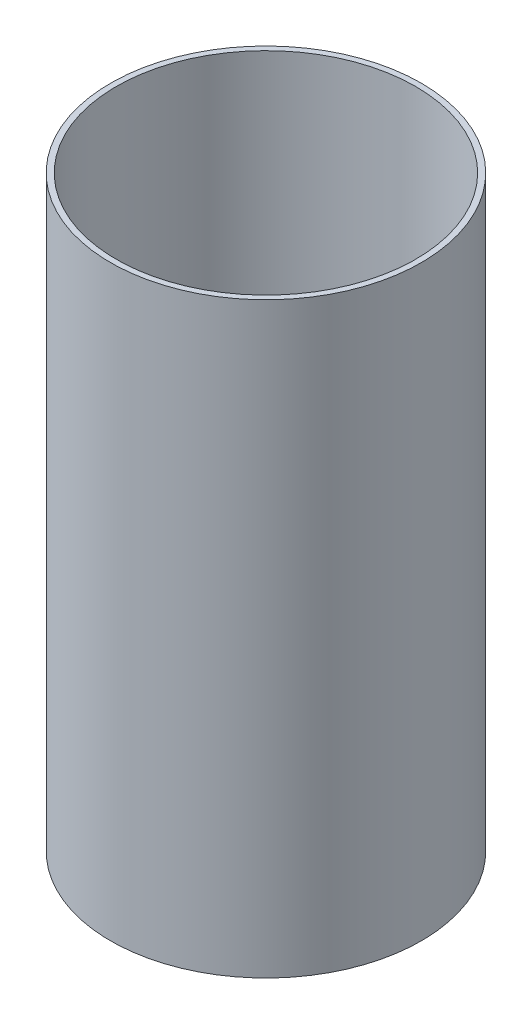
from build123d import *

# Parameters (mm, degrees)
SKETCH1_R           = 44.45
SKETCH1_R_2         = 42.82
BOSS_EXTRUDE1_DEPTH = 168


with BuildPart() as part:
    # Sketch1 → Boss-Extrude1 (new body)
    with BuildSketch(Plane(origin=(0, 0, 0), x_dir=(1, 0, 0), z_dir=(0, 1, 0))):
        Circle(SKETCH1_R)
        Circle(SKETCH1_R_2, mode=Mode.SUBTRACT)
    extrude(amount=BOSS_EXTRUDE1_DEPTH)


solid = part.part
